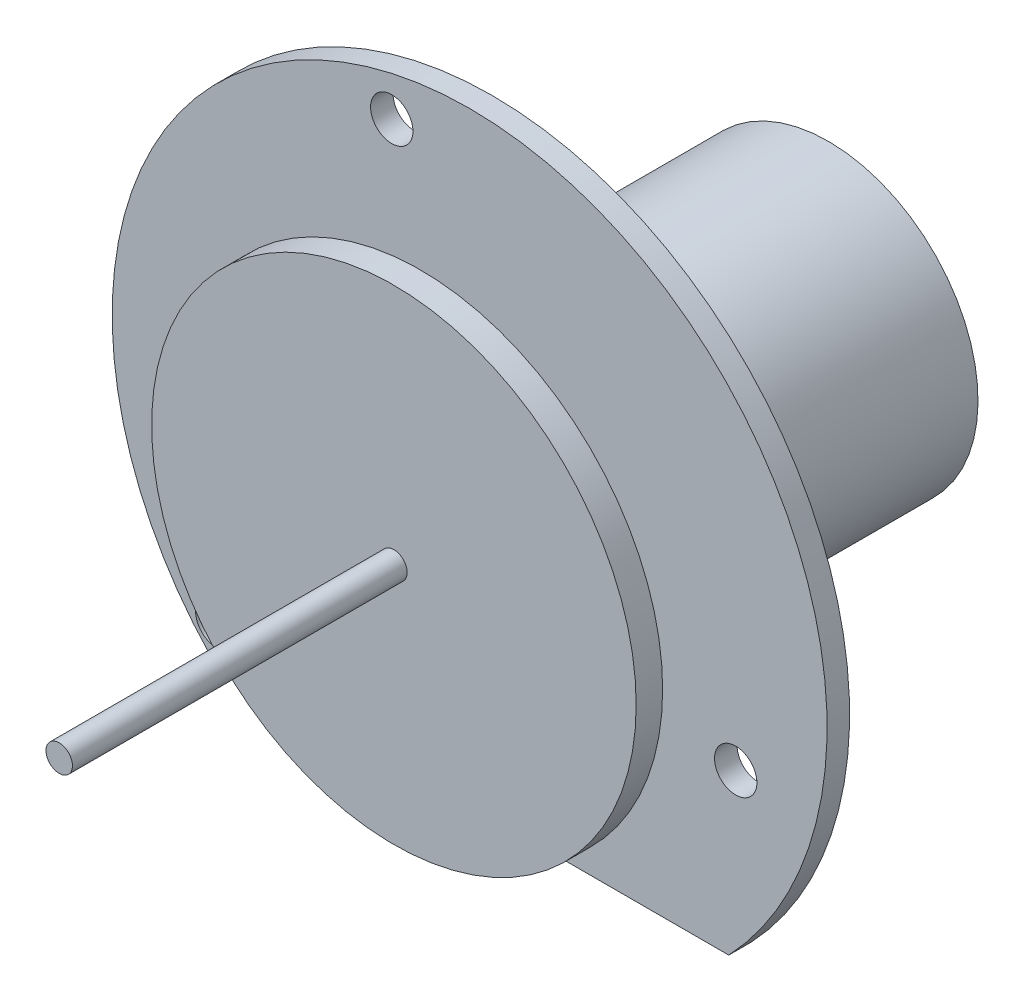
from build123d import *

# Parameters (mm, degrees)
SKETCH1_R           = 34.29
BOSS_EXTRUDE1_DEPTH = 2.159
SKETCH3_R           = 1.27
BOSS_EXTRUDE2_DEPTH = 39.37
SKETCH4_R           = 20.701
BOSS_EXTRUDE3_DEPTH = 2.032
SKETCH5_R           = 14.351
BOSS_EXTRUDE4_DEPTH = 30.226
CUT_EXTRUDE1_DEPTH  = 63.462829747
BOSS_EXTRUDE5_DEPTH = 7.62
SKETCH7_R           = 2.032
CUT_EXTRUDE2_DEPTH  = 63.462829747
SKETCH8_R           = 3.175
BOSS_EXTRUDE6_DEPTH = 4.7244
SKETCH9_R           = 23.241
BOSS_EXTRUDE7_DEPTH = 2.54


# Read off the part's stored shape, not the designer's step: Mirror1
with BuildPart() as part:
    # Sketch1 → Boss-Extrude1 (new body)
    with BuildSketch(Plane.XY):
        Circle(SKETCH1_R)
    extrude(amount=BOSS_EXTRUDE1_DEPTH)

    # Sketch3 → Boss-Extrude2 (add)
    with BuildSketch(Plane.XY.offset(2.159)):
        Circle(SKETCH3_R)
    extrude(amount=BOSS_EXTRUDE2_DEPTH)

    # Sketch4 → Boss-Extrude3 (add)
    with BuildSketch(Plane(origin=(0, 0, 0), x_dir=(-1, 0, 0), z_dir=(0, 0, -1))):
        Circle(SKETCH4_R)
    extrude(amount=BOSS_EXTRUDE3_DEPTH)

    # Sketch5 → Boss-Extrude4 (add)
    with BuildSketch(Plane(origin=(0, 0, -2.032), x_dir=(-1, 0, 0), z_dir=(0, 0, -1))):
        Circle(SKETCH5_R)
    extrude(amount=BOSS_EXTRUDE4_DEPTH)

    # Sketch2 → Cut-Extrude1 (cut, through all)
    with BuildSketch(Plane.XY.offset(2.159)):
        Polygon((0, -34.29), (-36.256055522, -34.29), (-36.256055522, -23.622), (33.75035888, -23.622), (33.75035888, -34.29), align=None)
    extrude(amount=-CUT_EXTRUDE1_DEPTH, mode=Mode.SUBTRACT)

    # Sketch6 → Boss-Extrude5 (add)
    with BuildSketch(Plane(origin=(0, 0, -2.032), x_dir=(-1, 0, 0), z_dir=(0, 0, -1))):
        with BuildLine():
            Line((-20.232022887, 4.381398281), (-13.655686281, 4.41287131))
            Line((-13.655686281, 4.41287131), (-13.634754112, -4.47712869))
            Line((-13.634754112, -4.47712869), (-20.211054393, -4.47712869))
            add(Edge.make_bspline(
                [(-20.232022887, 4.381398281), (-21.180346718, -0.048999972), (-20.211054393, -4.47712869)],
                knots=[0, 0, 0, 1, 1, 1], degree=2))
        make_face()
    extrude(amount=BOSS_EXTRUDE5_DEPTH)

    # Mirror1: part across plane


with BuildPart() as part_1:
    add(part.part)
    add(part.part.mirror(Plane(origin=(0, 0, 0), x_dir=(0, 0, 1), z_dir=(1, 0, 0))))

    # Sketch7 → Cut-Extrude2 (cut, through all)
    with BuildSketch(Plane.XY.offset(2.159)):
        with Locations((-24.261099887, -20.626476503)):
            Circle(SKETCH7_R)
        with Locations((-7.471969114, 29.665523497)):
            Circle(SKETCH7_R)
        with Locations((25.522900113, -7.952823738)):
            Circle(SKETCH7_R)
    extrude(amount=-CUT_EXTRUDE2_DEPTH, mode=Mode.SUBTRACT)

    # Sketch8 → Boss-Extrude6 (add)
    with BuildSketch(Plane.XY.offset(2.159)):
        Circle(SKETCH8_R)
    extrude(amount=BOSS_EXTRUDE6_DEPTH)

    # Sketch9 → Boss-Extrude7 (add)
    with BuildSketch(Plane.XY.offset(6.8834)):
        Circle(SKETCH9_R)
    extrude(amount=BOSS_EXTRUDE7_DEPTH)


solid = part_1.part
